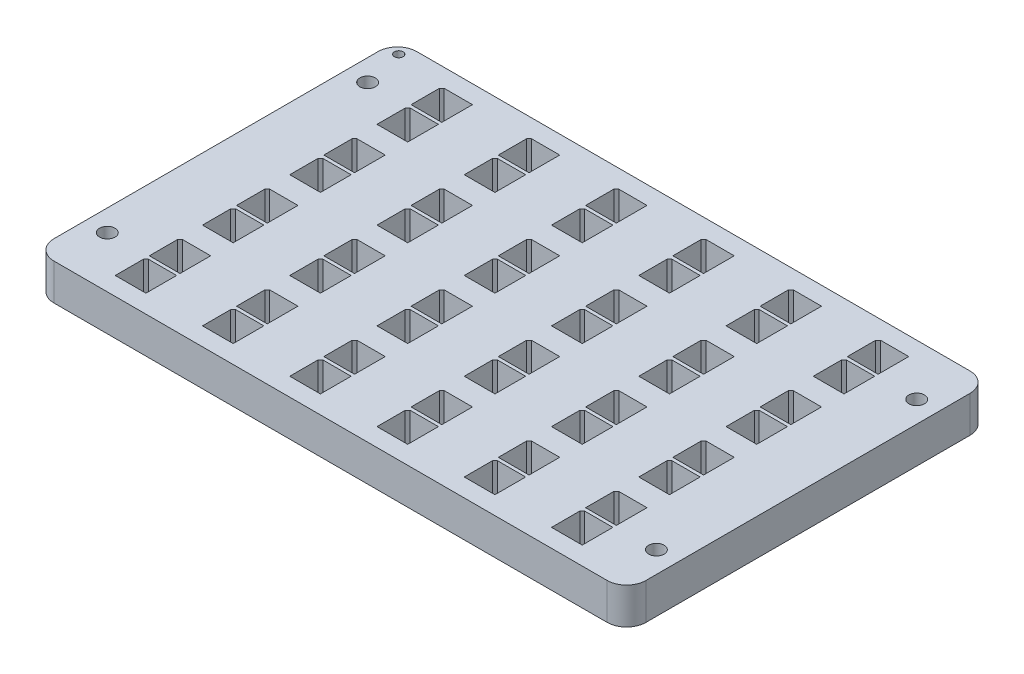
from build123d import *

# Parameters (mm, degrees)
SKETCH1_W           = 122.11
SKETCH1_H           = 74.85
SKETCH1_R           = 1.6
BOSS_EXTRUDE1_DEPTH = 7.5
SKETCH2_R           = 0.899215199
CUT_EXTRUDE1_DEPTH  = 73.004122451
FILLET1_R           = 4


with BuildPart() as part:
    # Sketch1 → Boss-Extrude1 (new body)
    with BuildSketch(Plane(origin=(0, 0, 0), x_dir=(1, 0, 0), z_dir=(0, 1, 0))):
        Rectangle(SKETCH1_W, SKETCH1_H)
        with Locations((-56.635, 26.85)):
            Circle(SKETCH1_R, mode=Mode.SUBTRACT)
        with Locations((56.635, 26.85)):
            Circle(SKETCH1_R, mode=Mode.SUBTRACT)
        with Locations((-56.635, -26.85)):
            Circle(SKETCH1_R, mode=Mode.SUBTRACT)
        with Locations((56.635, -26.85)):
            Circle(SKETCH1_R, mode=Mode.SUBTRACT)
    extrude(amount=BOSS_EXTRUDE1_DEPTH)

    # Sketch2 → Cut-Extrude1 (cut, through all)
    with BuildSketch(Plane(origin=(0, 7.5, 0), x_dir=(1, 0, 0), z_dir=(0, 1, 0))):
        with Locations((-58.44306736, 35.071414061)):
            Circle(SKETCH2_R)
        Polygon((-41.835, 33.68), (-41.835, 27.35), (-48.165, 27.35), (-48.165, 33.17116), (-47.65616, 33.68), align=None)
        Polygon((-41.835, 26.65), (-41.835, 20.32), (-48.165, 20.32), (-48.165, 26.14116), (-47.65616, 26.65), align=None)
        Polygon((-23.835, 33.68), (-23.835, 27.35), (-30.165, 27.35), (-30.165, 33.17116), (-29.65616, 33.68), align=None)
        Polygon((-23.835, 26.65), (-23.835, 20.32), (-30.165, 20.32), (-30.165, 26.14116), (-29.65616, 26.65), align=None)
        Polygon((-5.835, 33.68), (-5.835, 27.35), (-12.165, 27.35), (-12.165, 33.17116), (-11.65616, 33.68), align=None)
        Polygon((-5.835, 26.65), (-5.835, 20.32), (-12.165, 20.32), (-12.165, 26.14116), (-11.65616, 26.65), align=None)
        Polygon((12.165, 33.68), (12.165, 27.35), (5.835, 27.35), (5.835, 33.17116), (6.34384, 33.68), align=None)
        Polygon((12.165, 26.65), (12.165, 20.32), (5.835, 20.32), (5.835, 26.14116), (6.34384, 26.65), align=None)
        Polygon((30.165, 33.68), (30.165, 27.35), (23.835, 27.35), (23.835, 33.17116), (24.34384, 33.68), align=None)
        Polygon((30.165, 26.65), (30.165, 20.32), (23.835, 20.32), (23.835, 26.14116), (24.34384, 26.65), align=None)
        Polygon((48.165, 33.68), (48.165, 27.35), (41.835, 27.35), (41.835, 33.17116), (42.34384, 33.68), align=None)
        Polygon((48.165, 26.65), (48.165, 20.32), (41.835, 20.32), (41.835, 26.14116), (42.34384, 26.65), align=None)
        Polygon((-23.835, 15.68), (-23.835, 9.35), (-30.165, 9.35), (-30.165, 15.17116), (-29.65616, 15.68), align=None)
        Polygon((-23.835, 8.65), (-23.835, 2.32), (-30.165, 2.32), (-30.165, 8.14116), (-29.65616, 8.65), align=None)
        Polygon((-5.835, 15.68), (-5.835, 9.35), (-12.165, 9.35), (-12.165, 15.17116), (-11.65616, 15.68), align=None)
        Polygon((-5.835, 8.65), (-5.835, 2.32), (-12.165, 2.32), (-12.165, 8.14116), (-11.65616, 8.65), align=None)
        Polygon((12.165, 15.68), (12.165, 9.35), (5.835, 9.35), (5.835, 15.17116), (6.34384, 15.68), align=None)
        Polygon((12.165, 8.65), (12.165, 2.32), (5.835, 2.32), (5.835, 8.14116), (6.34384, 8.65), align=None)
        Polygon((30.165, 15.68), (30.165, 9.35), (23.835, 9.35), (23.835, 15.17116), (24.34384, 15.68), align=None)
        Polygon((30.165, 8.65), (30.165, 2.32), (23.835, 2.32), (23.835, 8.14116), (24.34384, 8.65), align=None)
        Polygon((48.165, 15.68), (48.165, 9.35), (41.835, 9.35), (41.835, 15.17116), (42.34384, 15.68), align=None)
        Polygon((48.165, 8.65), (48.165, 2.32), (41.835, 2.32), (41.835, 8.14116), (42.34384, 8.65), align=None)
        Polygon((-23.835, -2.32), (-23.835, -8.65), (-30.165, -8.65), (-30.165, -2.82884), (-29.65616, -2.32), align=None)
        Polygon((-23.835, -9.35), (-23.835, -15.68), (-30.165, -15.68), (-30.165, -9.85884), (-29.65616, -9.35), align=None)
        Polygon((-5.835, -2.32), (-5.835, -8.65), (-12.165, -8.65), (-12.165, -2.82884), (-11.65616, -2.32), align=None)
        Polygon((-5.835, -9.35), (-5.835, -15.68), (-12.165, -15.68), (-12.165, -9.85884), (-11.65616, -9.35), align=None)
        Polygon((12.165, -2.32), (12.165, -8.65), (5.835, -8.65), (5.835, -2.82884), (6.34384, -2.32), align=None)
        Polygon((12.165, -9.35), (12.165, -15.68), (5.835, -15.68), (5.835, -9.85884), (6.34384, -9.35), align=None)
        Polygon((30.165, -2.32), (30.165, -8.65), (23.835, -8.65), (23.835, -2.82884), (24.34384, -2.32), align=None)
        Polygon((30.165, -9.35), (30.165, -15.68), (23.835, -15.68), (23.835, -9.85884), (24.34384, -9.35), align=None)
        Polygon((48.165, -2.32), (48.165, -8.65), (41.835, -8.65), (41.835, -2.82884), (42.34384, -2.32), align=None)
        Polygon((48.165, -9.35), (48.165, -15.68), (41.835, -15.68), (41.835, -9.85884), (42.34384, -9.35), align=None)
        Polygon((-23.835, -20.32), (-23.835, -26.65), (-30.165, -26.65), (-30.165, -20.82884), (-29.65616, -20.32), align=None)
        Polygon((-23.835, -27.35), (-23.835, -33.68), (-30.165, -33.68), (-30.165, -27.85884), (-29.65616, -27.35), align=None)
        Polygon((-5.835, -20.32), (-5.835, -26.65), (-12.165, -26.65), (-12.165, -20.82884), (-11.65616, -20.32), align=None)
        Polygon((-5.835, -27.35), (-5.835, -33.68), (-12.165, -33.68), (-12.165, -27.85884), (-11.65616, -27.35), align=None)
        Polygon((12.165, -20.32), (12.165, -26.65), (5.835, -26.65), (5.835, -20.82884), (6.34384, -20.32), align=None)
        Polygon((12.165, -27.35), (12.165, -33.68), (5.835, -33.68), (5.835, -27.85884), (6.34384, -27.35), align=None)
        Polygon((30.165, -20.32), (30.165, -26.65), (23.835, -26.65), (23.835, -20.82884), (24.34384, -20.32), align=None)
        Polygon((30.165, -27.35), (30.165, -33.68), (23.835, -33.68), (23.835, -27.85884), (24.34384, -27.35), align=None)
        Polygon((48.165, -20.32), (48.165, -26.65), (41.835, -26.65), (41.835, -20.82884), (42.34384, -20.32), align=None)
        Polygon((48.165, -27.35), (48.165, -33.68), (41.835, -33.68), (41.835, -27.85884), (42.34384, -27.35), align=None)
        Polygon((-41.835, 15.68), (-41.835, 9.35), (-48.165, 9.35), (-48.165, 15.17116), (-47.65616, 15.68), align=None)
        Polygon((-41.835, 8.65), (-41.835, 2.32), (-48.165, 2.32), (-48.165, 8.14116), (-47.65616, 8.65), align=None)
        Polygon((-41.835, -2.32), (-41.835, -8.65), (-48.165, -8.65), (-48.165, -2.82884), (-47.65616, -2.32), align=None)
        Polygon((-41.835, -9.35), (-41.835, -15.68), (-48.165, -15.68), (-48.165, -9.85884), (-47.65616, -9.35), align=None)
        Polygon((-41.835, -20.32), (-41.835, -26.65), (-48.165, -26.65), (-48.165, -20.82884), (-47.65616, -20.32), align=None)
        Polygon((-41.835, -27.35), (-41.835, -33.68), (-48.165, -33.68), (-48.165, -27.85884), (-47.65616, -27.35), align=None)
    extrude(amount=-CUT_EXTRUDE1_DEPTH, mode=Mode.SUBTRACT)

    # Fillet1
    fillet1_edges = [part.edges().sort_by_distance(p)[0] for p in [
        (61.055, 3.75, 37.425),
        (-61.055, 3.75, 37.425),
        (61.055, 3.75, -37.425),
        (-61.055, 3.75, -37.425),
    ]]
    fillet(fillet1_edges, radius=FILLET1_R)


solid = part.part
